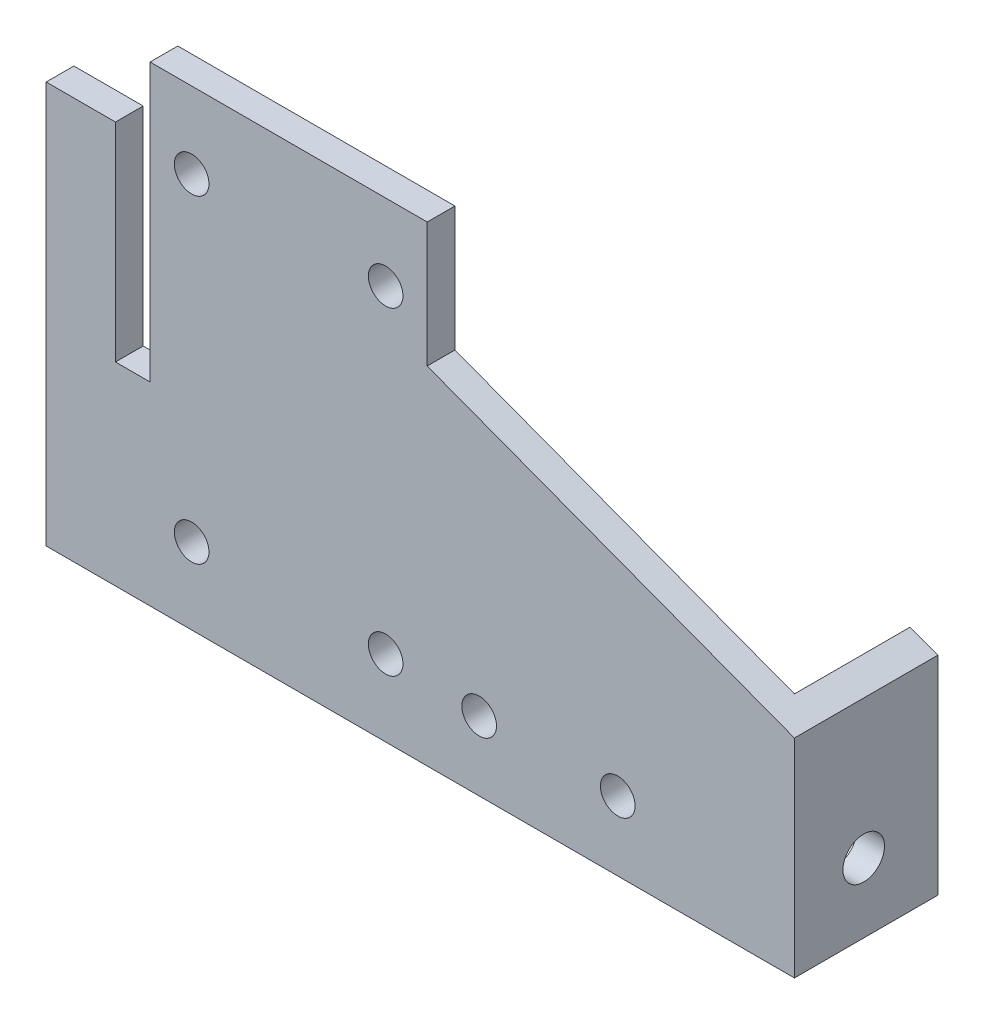
from build123d import *

# Parameters (mm, degrees)
SKETCH_1_R          = 2.5
EXTRUDE_1_DEPTH     = 4
EXTRUDE_2_DEPTH     = 20.7
SKETCH_3_R          = 3
CUT_EXTRUDE_1_DEPTH = 6.7
CUT_EXTRUDE_2_DEPTH = 10


with BuildPart() as part:
    # Эскиз1 → Бобышка-Вытянуть1 (new body)
    with BuildSketch(Plane.XY):
        Polygon((0, 0), (108, 0), (108, 30), (55, 50), (55, 68), (0, 68), align=None)
        with Locations((21, 57)):
            Circle(SKETCH_1_R, mode=Mode.SUBTRACT)
        with Locations((49, 57)):
            Circle(SKETCH_1_R, mode=Mode.SUBTRACT)
        with Locations((21, 11)):
            Circle(SKETCH_1_R, mode=Mode.SUBTRACT)
        with Locations((49, 11)):
            Circle(SKETCH_1_R, mode=Mode.SUBTRACT)
        with Locations((82.5, 10)):
            Circle(SKETCH_1_R, mode=Mode.SUBTRACT)
        with Locations((62.5, 10)):
            Circle(SKETCH_1_R, mode=Mode.SUBTRACT)
    extrude(amount=EXTRUDE_1_DEPTH)

    # Эскиз2 → Бобышка-Вытянуть2 (add)
    with BuildSketch(Plane.XY.offset(4)):
        Polygon((108, 0), (104, 0), (104, 31.509433962), (108, 30), align=None)
    extrude(amount=-EXTRUDE_2_DEPTH)

    # Эскиз3 → Вырез-Вытянуть1 (cut)
    with BuildSketch(Plane(origin=(108, 0, 0), x_dir=(0, 0, -1), z_dir=(1, 0, 0))):
        with Locations((6, 10)):
            Circle(SKETCH_3_R)
    extrude(amount=-CUT_EXTRUDE_1_DEPTH, mode=Mode.SUBTRACT)

    # Эскиз4 → Вырез-Вытянуть2 (cut)
    with BuildSketch(Plane(origin=(0, 0, 0), x_dir=(-1, 0, 0), z_dir=(0, 0, -1))):
        Polygon((0, 68), (-15, 68), (-15, 48), (-15, 28), (-10, 28), (-10, 58), (0, 58), align=None)
    extrude(amount=-CUT_EXTRUDE_2_DEPTH, mode=Mode.SUBTRACT)


solid = part.part
